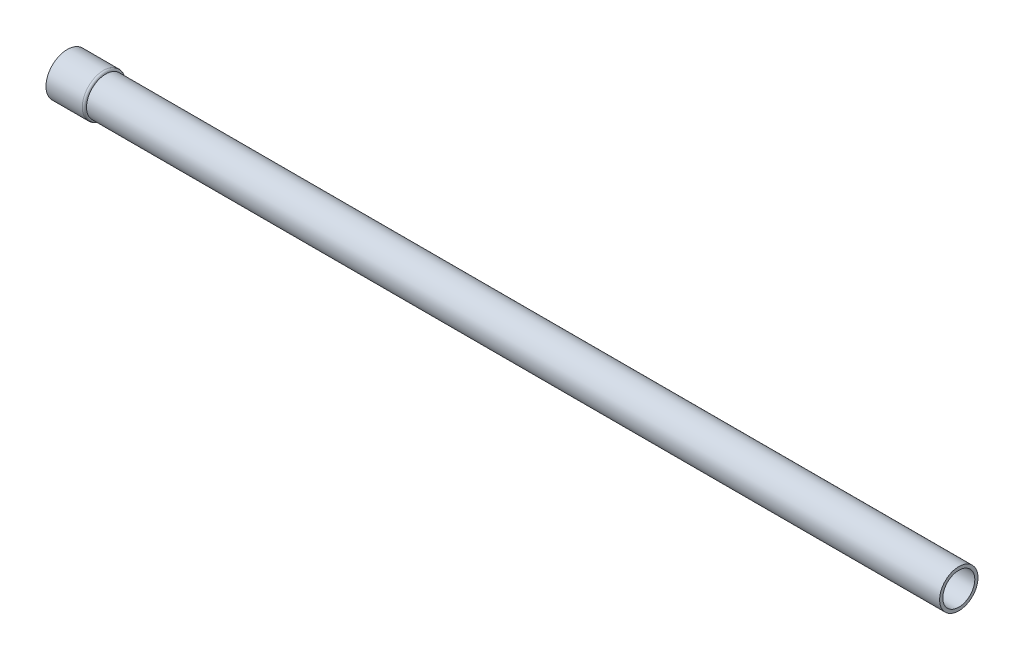
from build123d import *

# Parameters (mm, degrees)
SKETCH_1_R      = 9
SKETCH_1_R_2    = 7.5
EXTRUDE_2_DEPTH = 400
SKETCH_3_R      = 10
SKETCH_3_R_2    = 8.5
EXTRUDE_3_DEPTH = 18
FILLET_2_R      = 1


with BuildPart() as part:
    # 草圖1 → 填料-伸長2 (new body)
    with BuildSketch(Plane(origin=(0, 0, 0), x_dir=(0, 0, -1), z_dir=(1, 0, 0))):
        Circle(SKETCH_1_R)
        Circle(SKETCH_1_R_2, mode=Mode.SUBTRACT)
    extrude(amount=EXTRUDE_2_DEPTH)

    # 草圖3 → 填料-伸長3 (add)
    with BuildSketch(Plane.ZY.offset(18)):
        Circle(SKETCH_3_R)
        Circle(SKETCH_3_R_2, mode=Mode.SUBTRACT)
    extrude(amount=-EXTRUDE_3_DEPTH)

    # 圓角2
    fillet_2_edges = [part.edges().sort_by_distance(p)[0] for p in [
        (0, 0, -10),
    ]]
    fillet(fillet_2_edges, radius=FILLET_2_R - 0.0001)  # a hair under: the kernel refuses the full size


solid = part.part
